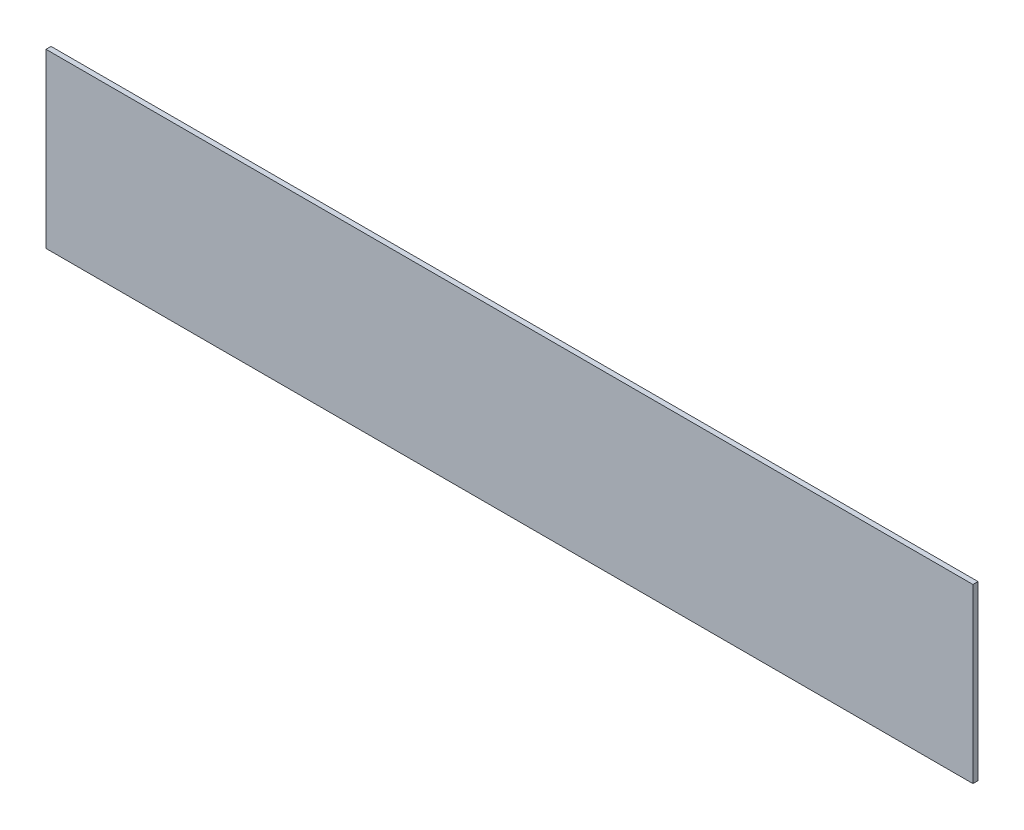
from build123d import *

# Parameters (mm, degrees)
SKETCH2_W           = 293
SKETCH2_H           = 54.52
BOSS_EXTRUDE1_DEPTH = 1.6


with BuildPart() as part:
    # Sketch2 → Boss-Extrude1 (new body)
    with BuildSketch(Plane.XY):
        Rectangle(SKETCH2_W, SKETCH2_H)
    extrude(amount=BOSS_EXTRUDE1_DEPTH)


solid = part.part
